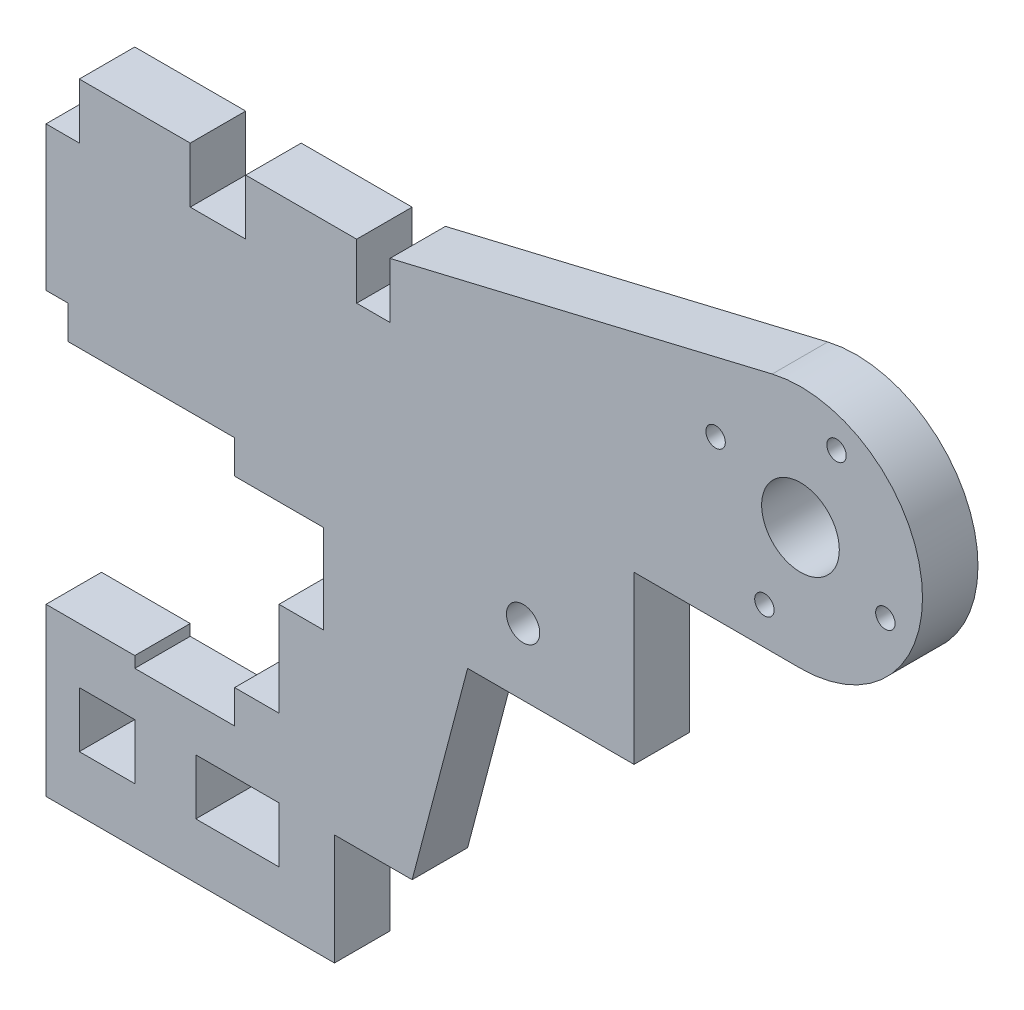
from build123d import *

# Parameters (mm, degrees)
ESQUISSE1_W        = 5
ESQUISSE1_H        = 5
ESQUISSE1_W_2      = 7.5
ESQUISSE1_R        = 1.5
ESQUISSE1_R_2      = 0.875
ESQUISSE1_R_3      = 3.5
BOSS_EXTRU_1_DEPTH = 5


with BuildPart() as part:
    # Esquisse1 → Boss.-Extru.1 (new body)
    with BuildSketch(Plane.XY):
        with BuildLine():
            Line((-8, 5), (-8, -10))
            Line((-8, -10), (18, -10))
            Line((18, -10), (18, 0))
            Line((18, 0), (25, 0))
            Line((25, 0), (30, 19))
            Line((30, 19), (45, 19))
            Line((45, 19), (45, 34))
            Line((45, 34), (60, 34))
            ThreePointArc((60, 34), (70.924996905, 46.282358225), (57.452770975, 55.701010433))
            Line((57.452770975, 55.701010433), (23, 47.5))
            Line((23, 47.5), (23, 42.5))
            Line((23, 42.5), (20, 42.5))
            Line((20, 42.5), (20, 47.5))
            Line((20, 47.5), (10, 47.5))
            Line((10, 47.5), (10, 42.5))
            Line((10, 42.5), (5, 42.5))
            Line((5, 42.5), (5, 47.5))
            Line((5, 47.5), (-5, 47.5))
            Line((-5, 47.5), (-5, 42.5))
            Line((-5, 42.5), (-8, 42.5))
            Line((-8, 42.5), (-8, 29.5))
            Line((-8, 29.5), (-6, 29.5))
            Line((-6, 29.5), (-6, 26.5))
            Line((-6, 26.5), (9, 26.5))
            Line((9, 26.5), (9, 23.5))
            Line((9, 23.5), (17, 23.5))
            Line((17, 23.5), (17, 15.5))
            Line((17, 15.5), (13, 15.5))
            Line((13, 15.5), (13, 7))
            Line((13, 7), (9, 7))
            Line((9, 7), (9, 4))
            Line((9, 4), (0, 4))
            Line((0, 4), (0, 5))
            Line((0, 5), (-8, 5))
        make_face()
        with Locations((-2.5, -2.5)):
            Rectangle(ESQUISSE1_W, ESQUISSE1_H, mode=Mode.SUBTRACT)
        with Locations((9.25, -2.5)):
            Rectangle(ESQUISSE1_W_2, ESQUISSE1_H, mode=Mode.SUBTRACT)
        with Locations((35, 25)):
            Circle(ESQUISSE1_R, mode=Mode.SUBTRACT)
        with Locations((56.75, 37.35)):
            Circle(ESQUISSE1_R_2, mode=Mode.SUBTRACT)
        with Locations((60, 45)):
            Circle(ESQUISSE1_R_3, mode=Mode.SUBTRACT)
        with Locations((67.65, 41.75)):
            Circle(ESQUISSE1_R_2, mode=Mode.SUBTRACT)
        with Locations((52.35, 48.25)):
            Circle(ESQUISSE1_R_2, mode=Mode.SUBTRACT)
        with Locations((63.25, 52.65)):
            Circle(ESQUISSE1_R_2, mode=Mode.SUBTRACT)
    extrude(amount=BOSS_EXTRU_1_DEPTH)


solid = part.part
